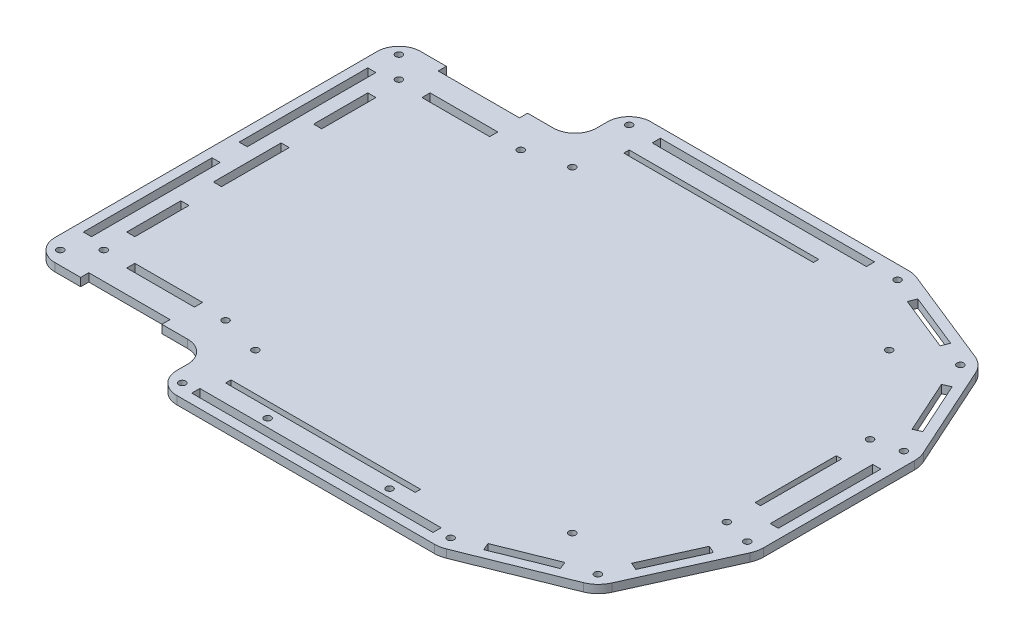
from build123d import *

# Parameters (mm, degrees)
ESTRUSIONE_ESTRUSIONE1_DEPTH  = 3
FORO_FILETTATO_M3X0_5_1_D     = 2.5
FORO_FILETTATO_M3X0_5_1_DEPTH = 7.5
FORO_FILETTATO_M3X0_5_1_TIP   = 0.751075774
SCHIZZO26_W                   = 30
SCHIZZO26_H                   = 3
TAGLIO_ESTRUSIONE12_DEPTH     = 10
SCHIZZO4_W                    = 79.084596206
SCHIZZO4_H                    = 3
TAGLIO_ESTRUSIONE2_DEPTH      = 10
FORO_FILETTATO_M3X0_5_7_D     = 2.5
SCHIZZO29_W                   = 5
SCHIZZO29_H                   = 3
TAGLIO_ESTRUSIONE13_DEPTH     = 10
SCHIZZO7_W                    = 3
SCHIZZO7_H                    = 47.5
TAGLIO_ESTRUSIONE5_DEPTH      = 10
SCHIZZO10_W                   = 3
SCHIZZO10_H                   = 37.84787706
TAGLIO_ESTRUSIONE6_DEPTH      = 247.100081268
FORO_FILETTATO_M3X0_5_2_D     = 2.5
SCHIZZO17_W                   = 25
SCHIZZO17_H                   = 3
SCHIZZO17_W_2                 = 3
SCHIZZO17_H_2                 = 20
SCHIZZO17_H_3                 = 25
TAGLIO_ESTRUSIONE9_DEPTH      = 10
SCHIZZO18_W                   = 70
SCHIZZO18_H                   = 2
TAGLIO_ESTRUSIONE10_DEPTH     = 10
FORO_FILETTATO_M3X0_5_3_D     = 2.5
SCHIZZO25_W                   = 2
SCHIZZO25_H                   = 30
TAGLIO_ESTRUSIONE11_DEPTH     = 10
FORO_FILETTATO_M3X0_5_6_D     = 2.5
RACCORDO1_R                   = 8
RACCORDO2_R                   = 10


with BuildPart() as part:
    # Schizzo1 → Estrusione-Estrusione1 (new body)
    with BuildSketch(Plane(origin=(0, 0, 0), x_dir=(1, 0, 0), z_dir=(0, 1, 0))):
        Polygon((65, 67.5), (65, 87.5), (170.052105959, 87.5), (211.585225273, 70.801270189), (230, 30), (230, -30), (211.585225273, -70.801270189), (170.052105959, -87.5), (65, -87.5), (65, -67.5), (0, -67.5), (0, 67.5), align=None)
    extrude(amount=ESTRUSIONE_ESTRUSIONE1_DEPTH)

    # Foro filettato M3x0.5-1
    with Locations(Plane(origin=(0, 3, 0), x_dir=(1, 0, 0), z_dir=(0, 1, 0))):
        with Locations((207.854862265, 66.912097904), (225, 28.92393853), (225, -28.92393853), (207.854862265, -66.912097904), (169.084596206, -82.5), (169.084596206, 82.5), (70, 82.5), (70, -82.5), (5, -62.5), (5, 62.5)):
            Hole(FORO_FILETTATO_M3X0_5_1_D / 2, depth=FORO_FILETTATO_M3X0_5_1_DEPTH)
            with Locations((0, 0, -(FORO_FILETTATO_M3X0_5_1_DEPTH + FORO_FILETTATO_M3X0_5_1_TIP / 2))):  # 118° drill point
                Cone(0, FORO_FILETTATO_M3X0_5_1_D / 2, FORO_FILETTATO_M3X0_5_1_TIP, mode=Mode.SUBTRACT)

    # Schizzo26 → Taglio-Estrusione12 (cut)
    with BuildSketch(Plane(origin=(0, 3, 0), x_dir=(1, 0, 0), z_dir=(0, 1, 0))):
        with Locations((32.5, -66)):
            Rectangle(SCHIZZO26_W, SCHIZZO26_H)
    taglio_estrusione12 = extrude(amount=-TAGLIO_ESTRUSIONE12_DEPTH, mode=Mode.SUBTRACT)

    # Specchia1: Taglio-Estrusione12 across plane
    add(taglio_estrusione12.mirror(Plane.XY), mode=Mode.SUBTRACT)

    # Schizzo4 → Taglio-Estrusione2 (cut)
    with BuildSketch(Plane(origin=(0, 3, 0), x_dir=(1, 0, 0), z_dir=(0, 1, 0))):
        with Locations((119.542298103, -82.5)):
            Rectangle(SCHIZZO4_W, SCHIZZO4_H)
        Polygon((219.519084515, 37.421559693), (210.601374282, 57.180362615), (213.33577775, 58.414476741), (222.253487983, 38.655673819), align=None)
        with Locations((119.542298103, 82.5)):
            Rectangle(SCHIZZO4_W, SCHIZZO4_H)
        Polygon((199.136249234, 72.034186035), (178.92231814, 80.161362114), (177.803209237, 77.377911869), (198.017140331, 69.250735791), align=None)
        Polygon((177.803209237, -77.377911869), (198.017140331, -69.250735791), (199.136249234, -72.034186035), (178.92231814, -80.161362114), align=None)
        Polygon((210.601374282, -57.180362615), (219.519084515, -37.421559693), (222.253487983, -38.655673819), (213.33577775, -58.414476741), align=None)
    extrude(amount=-TAGLIO_ESTRUSIONE2_DEPTH, mode=Mode.SUBTRACT)

    # Foro filettato M3x0.5-7 (through all)
    with Locations(Plane(origin=(0, 3, 0), x_dir=(1, 0, 0), z_dir=(0, 1, 0))):
        with Locations((97.042298103, -78), (142.042298103, -78)):
            Hole(FORO_FILETTATO_M3X0_5_7_D / 2)

    # Schizzo29 → Taglio-Estrusione13 (cut)
    with BuildSketch(Plane(origin=(0, 3, 0), x_dir=(1, 0, 0), z_dir=(0, 1, 0))):
        with Locations((77.5, -82.5)):
            Rectangle(SCHIZZO29_W, SCHIZZO29_H)
        with Locations((161.584596206, -82.5)):
            Rectangle(SCHIZZO29_W, SCHIZZO29_H)
    extrude(amount=-TAGLIO_ESTRUSIONE13_DEPTH, mode=Mode.SUBTRACT)

    # Schizzo7 → Taglio-Estrusione5 (cut)
    with BuildSketch(Plane(origin=(0, 3, 0), x_dir=(1, 0, 0), z_dir=(0, 1, 0))):
        with Locations((5, 28.75)):
            Rectangle(SCHIZZO7_W, SCHIZZO7_H)
        with Locations((5, -28.75)):
            Rectangle(SCHIZZO7_W, SCHIZZO7_H)
    extrude(amount=-TAGLIO_ESTRUSIONE5_DEPTH, mode=Mode.SUBTRACT)

    # Schizzo10 → Taglio-Estrusione6 (cut, through all)
    with BuildSketch(Plane(origin=(0, 3, 0), x_dir=(1, 0, 0), z_dir=(0, 1, 0))):
        with Locations((225, 0)):
            Rectangle(SCHIZZO10_W, SCHIZZO10_H)
    extrude(amount=-TAGLIO_ESTRUSIONE6_DEPTH, mode=Mode.SUBTRACT)

    # Foro filettato M3x0.5-2 (through all)
    with Locations(Plane(origin=(0, 3, 0), x_dir=(1, 0, 0), z_dir=(0, 1, 0))):
        with Locations((13, 54.5), (13, -54.5), (58, -54.5), (58, 54.5)):
            Hole(FORO_FILETTATO_M3X0_5_2_D / 2)

    # Schizzo17 → Taglio-Estrusione9 (cut)
    with BuildSketch(Plane(origin=(0, 3, 0), x_dir=(1, 0, 0), z_dir=(0, 1, 0))):
        with Locations((35.5, -54.5)):
            Rectangle(SCHIZZO17_W, SCHIZZO17_H)
        with Locations((13, -34.5)):
            Rectangle(SCHIZZO17_W_2, SCHIZZO17_H_2)
        with Locations((13, 34.5)):
            Rectangle(SCHIZZO17_W_2, SCHIZZO17_H_2)
        with Locations((35.5, 54.5)):
            Rectangle(SCHIZZO17_W, SCHIZZO17_H)
        with Locations((13, 0)):
            Rectangle(SCHIZZO17_W_2, SCHIZZO17_H_3)
    extrude(amount=-TAGLIO_ESTRUSIONE9_DEPTH, mode=Mode.SUBTRACT)

    # Schizzo18 → Taglio-Estrusione10 (cut)
    with BuildSketch(Plane(origin=(0, 3, 0), x_dir=(1, 0, 0), z_dir=(0, 1, 0))):
        with Locations((113, 73.5)):
            Rectangle(SCHIZZO18_W, SCHIZZO18_H)
        with Locations((113, -73.5)):
            Rectangle(SCHIZZO18_W, SCHIZZO18_H)
    extrude(amount=-TAGLIO_ESTRUSIONE10_DEPTH, mode=Mode.SUBTRACT)

    # Foro filettato M3x0.5-3 (through all)
    with Locations(Plane(origin=(0, 3, 0), x_dir=(1, 0, 0), z_dir=(0, 1, 0))):
        with Locations((215, 26.42393853), (215, -26.42393853)):
            Hole(FORO_FILETTATO_M3X0_5_3_D / 2)

    # Schizzo25 → Taglio-Estrusione11 (cut)
    with BuildSketch(Plane(origin=(0, 3, 0), x_dir=(1, 0, 0), z_dir=(0, 1, 0))):
        with Locations((215, 0)):
            Rectangle(SCHIZZO25_W, SCHIZZO25_H)
    extrude(amount=-TAGLIO_ESTRUSIONE11_DEPTH, mode=Mode.SUBTRACT)

    # Foro filettato M3x0.5-6 (through all)
    with Locations(Plane(origin=(0, 3, 0), x_dir=(1, 0, 0), z_dir=(0, 1, 0))):
        with Locations((73, 58.5), (190, 58.5), (190, -58.5), (73, -58.5)):
            Hole(FORO_FILETTATO_M3X0_5_6_D / 2)

    # Raccordo1
    raccordo1_edges = [part.edges().sort_by_distance(p)[0] for p in [
        (0, 1.5, 67.5),
        (0, 1.5, -67.5),
        (65, 1.5, -87.5),
        (65, 1.5, 87.5),
        (65, 1.5, 67.5),
        (65, 1.5, -67.5),
    ]]
    fillet(raccordo1_edges, radius=RACCORDO1_R)

    # Raccordo2
    raccordo2_edges = [part.edges().sort_by_distance(p)[0] for p in [
        (170.052105959, 1.5, -87.5),
        (211.585225273, 1.5, -70.801270189),
        (230, 1.5, -30),
        (230, 1.5, 30),
        (211.585225273, 1.5, 70.801270189),
        (170.052105959, 1.5, 87.5),
    ]]
    fillet(raccordo2_edges, radius=RACCORDO2_R)


solid = part.part
